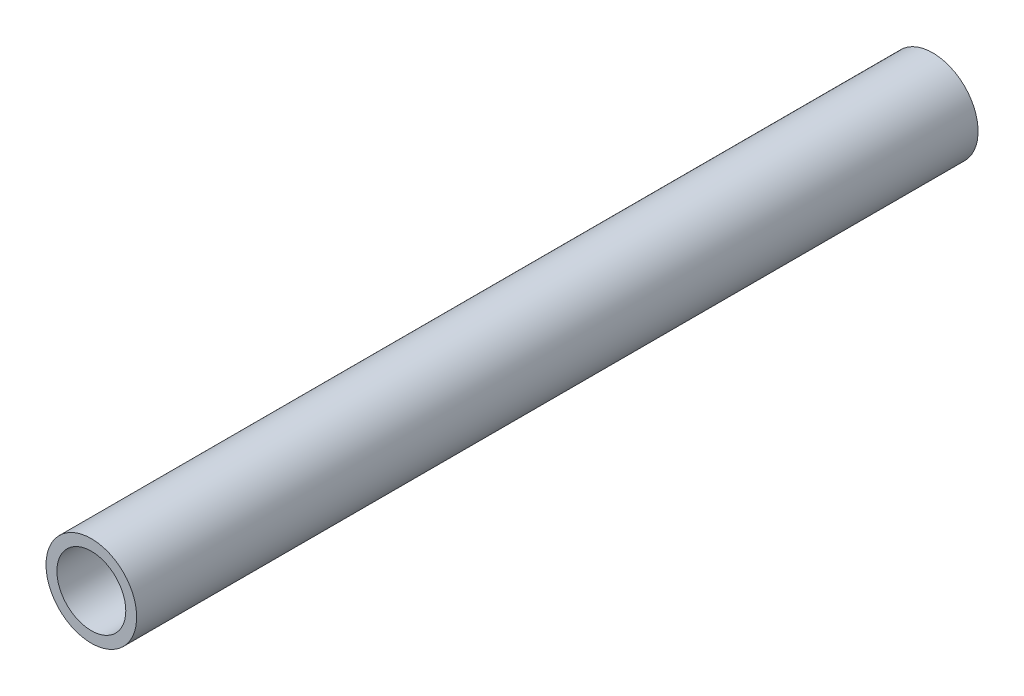
from build123d import *

# Parameters (mm, degrees)
SKETCH1_R           = 12.5
BOSS_EXTRUDE1_DEPTH = 232
SKETCH2_R           = 9.5
CUT_EXTRUDE1_DEPTH  = 252


with BuildPart() as part:
    # Sketch1 → Boss-Extrude1 (new body)
    with BuildSketch(Plane.XY.offset(230)):
        with Locations((300, 300)):
            Circle(SKETCH1_R)
    extrude(amount=BOSS_EXTRUDE1_DEPTH)

    # Sketch2 → Cut-Extrude1 (cut)
    with BuildSketch(Plane.XY.offset(462)):
        with Locations((300, 300)):
            Circle(SKETCH2_R)
    extrude(amount=-CUT_EXTRUDE1_DEPTH, mode=Mode.SUBTRACT)


solid = part.part
